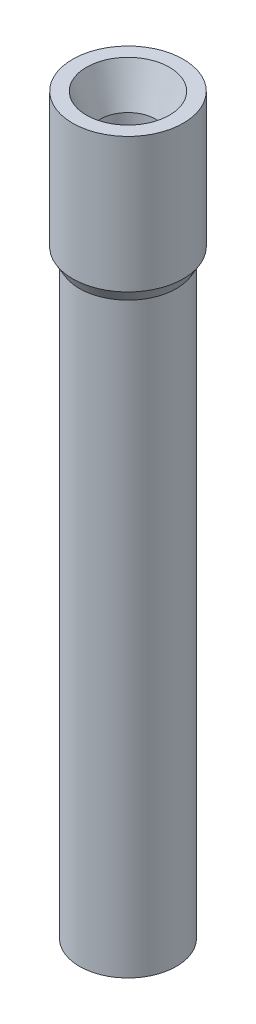
from build123d import *

# Parameters (mm, degrees)
SKETCH_1_R          = 4
EXTRUDE_1_DEPTH     = 8
SKETCH_2_R          = 3.5
EXTRUDE_2_DEPTH     = 45
CHAMFER_1_SIZE      = 1.5
CHAMFER_1_SIZE_2    = 2.598076211
SKETCH_3_R          = 2
CUT_EXTRUDE_1_DEPTH = 101
CHAMFER_2_SIZE      = 1
CHAMFER_2_SIZE2     = 2.747477419


with BuildPart() as part:
    # 草图1 → 凸台-拉伸1 (new body)
    with BuildSketch(Plane(origin=(0, 0, 0), x_dir=(1, 0, 0), z_dir=(0, 1, 0))):
        with Locations(Location((0, 0, 0), (0, 0, 270))):
            Circle(SKETCH_1_R)
    extrude(amount=EXTRUDE_1_DEPTH)

    # 草图2 → 凸台-拉伸2 (add)
    with BuildSketch(Plane.XZ):
        with Locations(Location((0, 0, 0), (0, 0, 90))):
            Circle(SKETCH_2_R)
    extrude(amount=EXTRUDE_2_DEPTH)

    # 倒角1
    # the kernel refuses this chamfer: 2.598076211, 1.5 mm, written as the material it adds along each edge
    with BuildSketch(Plane(origin=(0, 0, 0), x_dir=(0, 0, 1), z_dir=(1, 0, 0))) as chamfer_1_piece_1_section:
        Polygon((3.5 + CHAMFER_1_SIZE, 0), (3.5, CHAMFER_1_SIZE_2), (3.5, 0), align=None)
    chamfer_1_piece_1 = revolve(axis=Axis((0, 0, 0), (0, -1, 0)), mode=Mode.PRIVATE)
    chamfer_1_piece_1 = chamfer_1_piece_1 & Plane(origin=(0, -2.194625368, 0), x_dir=(0, 0, 1), z_dir=(0, -1, 0)) * Cylinder(4, 20, mode=Mode.PRIVATE)
    add(chamfer_1_piece_1)

    # 草图3 → 切除-拉伸1 (cut)
    with BuildSketch(Plane.XZ.offset(45)):
        with Locations(Location((0, 0, 0), (0, 0, 270))):
            Circle(SKETCH_3_R)
    extrude(amount=-CUT_EXTRUDE_1_DEPTH, mode=Mode.SUBTRACT)

    # 倒角2
    chamfer_2_edges = [part.edges().sort_by_distance(p)[0] for p in [
        (0, 8, 2),
    ]]
    chamfer_2_side = [part.faces().sort_by_distance(p)[0] for p in [
        (0, 8, -3.886862915),
    ]]
    chamfer(chamfer_2_edges, length=CHAMFER_2_SIZE, length2=CHAMFER_2_SIZE2, reference=chamfer_2_side[0])


solid = part.part
